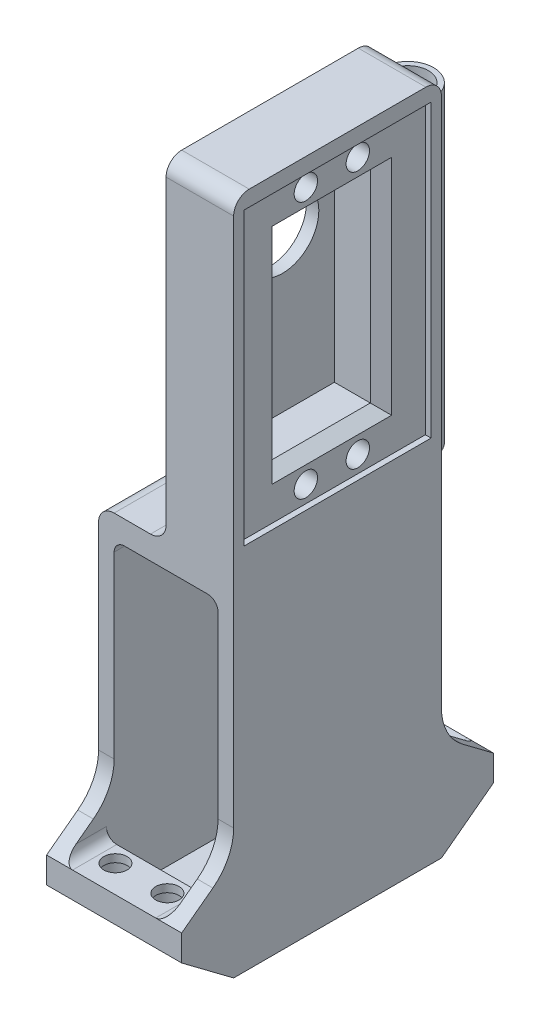
from build123d import *

# Parameters (mm, degrees)
SKETCH_1_W               = 26
SKETCH_1_H               = 60
EXTRUDE_1_DEPTH          = 130
SKETCH_3_W               = 20
SKETCH_3_H               = 49
CUT_EXTRUDE_1_DEPTH      = 180
SKETCH_4_W               = 20
SKETCH_4_H               = 40
CUT_EXTRUDE_3_DEPTH      = 10.5
SKETCH_14_W              = 26
SKETCH_14_H              = 117.5
SKETCH_14_H_2            = 7.5
CUT_EXTRUDE_13_DEPTH     = 10
CUT_EXTRUDE_4_REACH      = 147.52
SKETCH_5_R               = 2.25
CUT_EXTRUDE_2_REACH      = 147.52
SKETCH_2_R               = 7
SKETCH_7_W               = 40
SKETCH_7_H               = 64
CUT_EXTRUDE_5_DEPTH      = 13
SKETCH_6_W               = 20
SKETCH_6_H               = 40
CUT_EXTRUDE_6_DEPTH      = 10.6
SKETCH_8_W               = 36
SKETCH_8_H               = 56
CUT_EXTRUDE_7_DEPTH      = 1.1
SKETCH_9_R               = 7
CUT_EXTRUDE_8_DEPTH      = 145.004027721
SKETCH_10_R              = 2.25
CUT_EXTRUDE_9_DEPTH      = 146.327251402
SKETCH_11_R              = 3.85
CUT_EXTRUDE_10_DEPTH     = 4.7
SKETCH_12_R              = 3.85
CUT_EXTRUDE_11_DEPTH     = 3.5
RIB_2_REACH              = 147.52
SKETCH_16_WALL_W         = 305.539516218
SKETCH_16_WALL_H         = 3
MIRROR_3_COPY_1_REACH    = 147.52
MIRROR_3_COPY_1_SKETCH_W = 305.539516218
MIRROR_3_COPY_1_SKETCH_H = 3
MIRROR_4_COPY_1_REACH    = 147.52
MIRROR_4_COPY_1_SKETCH_W = 305.539516218
MIRROR_4_COPY_1_SKETCH_H = 3
MIRROR_4_COPY_2_REACH    = 147.52
MIRROR_4_COPY_2_SKETCH_W = 305.539516218
MIRROR_4_COPY_2_SKETCH_H = 3
MIRROR_4_COPY_3_REACH    = 147.52
MIRROR_4_COPY_3_SKETCH_W = 305.539516218
MIRROR_4_COPY_3_SKETCH_H = 3
EXTRUDE_START            = -4
EXTRUDE_2_DEPTH          = 60
FILLET_3_R               = 2
CHAMFER_1_SIZE           = 1.5
CHAMFER_1_SIZE_2         = 2.598076211
FILLET_4_R               = 3
FILLET_5_R               = 10
FILLET_6_R               = 1


# Some blends are built 0.0001 mm under size
with BuildPart() as part:
    # 草图1 → 凸台-拉伸1 (new body)
    with BuildSketch(Plane(origin=(0, 0, 0), x_dir=(1, 0, 0), z_dir=(0, 1, 0))):
        with Locations((13, -30)):
            Rectangle(SKETCH_1_W, SKETCH_1_H)
    extrude(amount=EXTRUDE_1_DEPTH)

    # 草图3 → 切除-拉伸1 (cut)
    with BuildSketch(Plane(origin=(0, 0, 0), x_dir=(-1, 0, 0), z_dir=(0, 0, -1))):
        with Locations((-13, 37)):
            Rectangle(SKETCH_3_W, SKETCH_3_H)
    extrude(amount=-CUT_EXTRUDE_1_DEPTH, mode=Mode.SUBTRACT)

    # 草图4 → 切除-拉伸3 (cut)
    with BuildSketch(Plane(origin=(0, 12.5, 0), x_dir=(1, 0, 0), z_dir=(0, 1, 0))):
        with Locations((13, -30)):
            Rectangle(SKETCH_4_W, SKETCH_4_H)
    extrude(amount=-CUT_EXTRUDE_3_DEPTH, mode=Mode.SUBTRACT)

    # 草图14 → 切除-拉伸13 (cut)
    with BuildSketch(Plane(origin=(0, 0, 0), x_dir=(-1, 0, 0), z_dir=(0, 0, -1))):
        with Locations((-13, 71.25)):
            Rectangle(SKETCH_14_W, SKETCH_14_H)
        with Locations((-13, 3.75)):
            Rectangle(SKETCH_14_W, SKETCH_14_H_2)
    cut_extrude_13 = extrude(amount=-CUT_EXTRUDE_13_DEPTH, mode=Mode.SUBTRACT)

    # 镜向1: 切除-拉伸13 across plane
    add(cut_extrude_13.mirror(Plane(origin=(0, 0, 30), x_dir=(1, 0, 0), z_dir=(0, 0, -1))), mode=Mode.SUBTRACT)

    # 草图5 → 切除-拉伸4 (cut, up to next)
    with BuildSketch(Plane.XZ, mode=Mode.PRIVATE) as cut_extrude_4_sk1:
        with Locations(Location((18, 54.75, 0), (0, 0, 270))):
            Circle(SKETCH_5_R)
    cut_extrude_4_tool1 = extrude(cut_extrude_4_sk1.sketch, amount=-CUT_EXTRUDE_4_REACH, mode=Mode.PRIVATE) & part.part
    # 草图5 → 切除-拉伸4 (cut, up to next)
    with BuildSketch(Plane.XZ, mode=Mode.PRIVATE) as cut_extrude_4_sk2:
        with Locations(Location((8, 54.75, 0), (0, 0, 270))):
            Circle(SKETCH_5_R)
    cut_extrude_4_tool2 = extrude(cut_extrude_4_sk2.sketch, amount=-CUT_EXTRUDE_4_REACH, mode=Mode.PRIVATE) & part.part
    # 草图5 → 切除-拉伸4 (cut, up to next)
    with BuildSketch(Plane.XZ, mode=Mode.PRIVATE) as cut_extrude_4_sk3:
        with Locations(Location((18, 5.25, 0), (0, 0, 270))):
            Circle(SKETCH_5_R)
    cut_extrude_4_tool3 = extrude(cut_extrude_4_sk3.sketch, amount=-CUT_EXTRUDE_4_REACH, mode=Mode.PRIVATE) & part.part
    # 草图5 → 切除-拉伸4 (cut, up to next)
    with BuildSketch(Plane.XZ, mode=Mode.PRIVATE) as cut_extrude_4_sk4:
        with Locations(Location((8, 5.25, 0), (0, 0, 270))):
            Circle(SKETCH_5_R)
    cut_extrude_4_tool4 = extrude(cut_extrude_4_sk4.sketch, amount=-CUT_EXTRUDE_4_REACH, mode=Mode.PRIVATE) & part.part
    add(cut_extrude_4_tool1.solids().sort_by_distance((18, 0, 54.75))[0], mode=Mode.SUBTRACT)
    add(cut_extrude_4_tool2.solids().sort_by_distance((8, 0, 54.75))[0], mode=Mode.SUBTRACT)
    add(cut_extrude_4_tool3.solids().sort_by_distance((18, 0, 5.25))[0], mode=Mode.SUBTRACT)
    add(cut_extrude_4_tool4.solids().sort_by_distance((8, 0, 5.25))[0], mode=Mode.SUBTRACT)

    # 草图2 → 切除-拉伸2 (cut, up to next)
    with BuildSketch(Plane.XZ, mode=Mode.PRIVATE) as cut_extrude_2_sk1:
        with Locations(Location((13, 20, 0), (0, 0, 270))):
            Circle(SKETCH_2_R)
    cut_extrude_2_tool1 = extrude(cut_extrude_2_sk1.sketch, amount=-CUT_EXTRUDE_2_REACH, mode=Mode.PRIVATE) & part.part
    add(cut_extrude_2_tool1.solids().sort_by_distance((13, 0, 20))[0], mode=Mode.SUBTRACT)

    # 草图7 → 切除-拉伸5 (cut)
    with BuildSketch(Plane.ZY):
        with Locations((30, 98)):
            Rectangle(SKETCH_7_W, SKETCH_7_H)
    extrude(amount=-CUT_EXTRUDE_5_DEPTH, mode=Mode.SUBTRACT)

    # 草图6 → 切除-拉伸6 (cut)
    with BuildSketch(Plane(origin=(26, 0, 0), x_dir=(0, 0, -1), z_dir=(1, 0, 0))):
        with Locations((-30, 99)):
            Rectangle(SKETCH_6_W, SKETCH_6_H)
    extrude(amount=-CUT_EXTRUDE_6_DEPTH, mode=Mode.SUBTRACT)

    # 草图8 → 切除-拉伸7 (cut)
    with BuildSketch(Plane(origin=(26, 0, 0), x_dir=(0, 0, -1), z_dir=(1, 0, 0))):
        with Locations((-30, 99)):
            Rectangle(SKETCH_8_W, SKETCH_8_H)
    extrude(amount=-CUT_EXTRUDE_7_DEPTH, mode=Mode.SUBTRACT)

    # 草图9 → 切除-拉伸8 (cut, through all)
    with BuildSketch(Plane(origin=(15.4, 0, 0), x_dir=(0, 0, -1), z_dir=(1, 0, 0))):
        with Locations((-30, 109.15)):
            Circle(SKETCH_9_R)
    extrude(amount=-CUT_EXTRUDE_8_DEPTH, mode=Mode.SUBTRACT)

    # 草图10 → 切除-拉伸9 (cut, through all)
    with BuildSketch(Plane(origin=(24.9, 0, 0), x_dir=(0, 0, -1), z_dir=(1, 0, 0))):
        with Locations((-25, 123.75)):
            Circle(SKETCH_10_R)
        with Locations(Location((-35, 123.75, 0), (0, 0, 180))):
            Circle(SKETCH_10_R)
        with Locations((-35, 74.25)):
            Circle(SKETCH_10_R)
        with Locations(Location((-25, 74.25, 0), (0, 0, 180))):
            Circle(SKETCH_10_R)
    extrude(amount=-CUT_EXTRUDE_9_DEPTH, mode=Mode.SUBTRACT)

    # 草图11 → 切除-拉伸10 (cut)
    with BuildSketch(Plane.ZY.offset(-13)):
        with Locations((25, 123.75)):
            Circle(SKETCH_11_R)
        with Locations((35, 123.75)):
            Circle(SKETCH_11_R)
        with Locations((35, 74.25)):
            Circle(SKETCH_11_R)
        with Locations((25, 74.25)):
            Circle(SKETCH_11_R)
    extrude(amount=-CUT_EXTRUDE_10_DEPTH, mode=Mode.SUBTRACT)

    # 草图12 → 切除-拉伸11 (cut)
    with BuildSketch(Plane.XZ.offset(-7.5)):
        with Locations((8, 54.75)):
            Circle(SKETCH_12_R)
        with Locations((18, 54.75)):
            Circle(SKETCH_12_R)
        with Locations((18, 5.25)):
            Circle(SKETCH_12_R)
        with Locations((8, 5.25)):
            Circle(SKETCH_12_R)
    extrude(amount=-CUT_EXTRUDE_11_DEPTH, mode=Mode.SUBTRACT)

    # 草图16 wall → 筋2 (add, up to next)
    with BuildSketch(Plane(origin=(26, 3.75, 5), x_dir=(0, -0.6, 0.8), z_dir=(0, -0.8, -0.6)), mode=Mode.PRIVATE) as rib_2_sk1:
        with Locations((0, 1.5)):
            Rectangle(SKETCH_16_WALL_W, SKETCH_16_WALL_H)
    rib_2_tool1 = extrude(rib_2_sk1.sketch, amount=-RIB_2_REACH, mode=Mode.PRIVATE) - part.part
    rib_2 = rib_2_tool1.solids().sort_by_distance((26, 3.75, 5))[0]
    add(rib_2)

    # 镜向2: 筋2 across plane
    add(rib_2.mirror(Plane.ZY.offset(-13)))

    # 镜向3: 筋2 across plane
    add(rib_2.mirror(Plane(origin=(0, 0, 30), x_dir=(1, 0, 0), z_dir=(0, 0, -1))))

    # 镜向3 copy 1 sketch → 镜向3 copy 1 (add, up to next)
    with BuildSketch(Plane(origin=(0, 3.75, 55), x_dir=(0, -0.6, -0.8), z_dir=(0, -0.8, 0.6)), mode=Mode.PRIVATE) as mirror_3_copy_1_sk1:
        with Locations((0, 1.5)):
            Rectangle(MIRROR_3_COPY_1_SKETCH_W, MIRROR_3_COPY_1_SKETCH_H)
    mirror_3_copy_1_tool1 = extrude(mirror_3_copy_1_sk1.sketch, amount=-MIRROR_3_COPY_1_REACH, mode=Mode.PRIVATE) - part.part
    add(mirror_3_copy_1_tool1.solids().sort_by_distance((0, 3.75, 55))[0])

    # 镜向4: 筋2 across plane
    add(rib_2.mirror(Plane(origin=(0, 10, 0), x_dir=(0, 0, 1), z_dir=(0, -1, 0))))

    # 镜向4 copy 1 sketch → 镜向4 copy 1 (add, up to next)
    with BuildSketch(Plane(origin=(0, 16.25, 5), x_dir=(0, 0.6, 0.8), z_dir=(0, 0.8, -0.6)), mode=Mode.PRIVATE) as mirror_4_copy_1_sk1:
        with Locations((0, 1.5)):
            Rectangle(MIRROR_4_COPY_1_SKETCH_W, MIRROR_4_COPY_1_SKETCH_H)
    mirror_4_copy_1_tool1 = extrude(mirror_4_copy_1_sk1.sketch, amount=-MIRROR_4_COPY_1_REACH, mode=Mode.PRIVATE) - part.part
    add(mirror_4_copy_1_tool1.solids().sort_by_distance((0, 16.25, 5))[0])

    # 镜向4 copy 2 sketch → 镜向4 copy 2 (add, up to next)
    with BuildSketch(Plane(origin=(26, 16.25, 55), x_dir=(0, 0.6, -0.8), z_dir=(0, 0.8, 0.6)), mode=Mode.PRIVATE) as mirror_4_copy_2_sk1:
        with Locations((0, 1.5)):
            Rectangle(MIRROR_4_COPY_2_SKETCH_W, MIRROR_4_COPY_2_SKETCH_H)
    mirror_4_copy_2_tool1 = extrude(mirror_4_copy_2_sk1.sketch, amount=-MIRROR_4_COPY_2_REACH, mode=Mode.PRIVATE) - part.part
    add(mirror_4_copy_2_tool1.solids().sort_by_distance((26, 16.25, 55))[0])

    # 镜向4 copy 3 sketch → 镜向4 copy 3 (add, up to next)
    with BuildSketch(Plane(origin=(0, 16.25, 55), x_dir=(0, 0.6, -0.8), z_dir=(0, 0.8, 0.6)), mode=Mode.PRIVATE) as mirror_4_copy_3_sk1:
        with Locations((0, -1.5)):
            Rectangle(MIRROR_4_COPY_3_SKETCH_W, MIRROR_4_COPY_3_SKETCH_H)
    mirror_4_copy_3_tool1 = extrude(mirror_4_copy_3_sk1.sketch, amount=-MIRROR_4_COPY_3_REACH, mode=Mode.PRIVATE) - part.part
    add(mirror_4_copy_3_tool1.solids().sort_by_distance((0, 16.25, 55))[0])

    # 草图17 → 凸台-拉伸2 (add)
    with BuildSketch(Plane(origin=(0, 130, 0), x_dir=(1, 0, 0), z_dir=(0, 1, 0)).offset(EXTRUDE_START)):
        with BuildLine():
            Line((14.5, -10), (15.5, -10))
            ThreePointArc((15.5, -10), (19.5, -6), (23.5, -10))
            Line((23.5, -10), (24.5, -10))
            ThreePointArc((24.5, -10), (19.5, -5), (14.5, -10))
        make_face()
    extrude(amount=-EXTRUDE_2_DEPTH)

    # 圆角3
    fillet_3_edges = [part.edges().sort_by_distance(p)[0] for p in [
        (3, 12.5, 55),
        (23, 12.5, 55),
        (3, 12.5, 5),
        (23, 12.5, 5),
        (23, 61.5, 30),
        (3, 61.5, 30),
    ]]
    fillet(fillet_3_edges, radius=FILLET_3_R)

    # 倒角1
    # the kernel refuses this chamfer: 2.598076211, 1.5 mm, written as the material it takes off along each edge
    with BuildSketch(Plane(origin=(24.9, 119, 40), x_dir=(0, 1, 0), z_dir=(0, 0, -1)), Plane(origin=(24.9, 79, 20), x_dir=(0, -1, 0), z_dir=(0, 0, 1))) as chamfer_1_piece_1:
        Polygon((CHAMFER_1_SIZE, 0), (0, -CHAMFER_1_SIZE_2), (0, 0), align=None)
    extrude(amount=20, mode=Mode.SUBTRACT)
    with BuildSketch(Plane(origin=(24.9, 79, 40), x_dir=(0, 0, 1), z_dir=(0, 1, 0)), Plane(origin=(24.9, 119, 20), x_dir=(0, 0, -1), z_dir=(0, -1, 0))) as chamfer_1_piece_2:
        Polygon((CHAMFER_1_SIZE, 0), (0, -CHAMFER_1_SIZE_2), (0, 0), align=None)
    extrude(amount=40, mode=Mode.SUBTRACT)
    with BuildSketch(Plane(origin=(5, 12.5, 10), x_dir=(0, -1, 0), z_dir=(1, 0, 0)), Plane(origin=(21, 12.5, 50), x_dir=(0, -1, 0), z_dir=(-1, 0, 0))) as chamfer_1_piece_3:
        Polygon((CHAMFER_1_SIZE_2, 0), (0, CHAMFER_1_SIZE), (0, 0), align=None)
    extrude(amount=16, mode=Mode.SUBTRACT)
    with BuildSketch(Plane(origin=(21, 14.5, 10), x_dir=(-0.9757925092346341, -0.21869837430026012, 0), z_dir=(0.21869837430026012, -0.9757925092346341, 0))) as chamfer_1_piece_4_section:
        Polygon((2 + CHAMFER_1_SIZE_2, 0), (2, CHAMFER_1_SIZE), (2, 0), align=None)
    chamfer_1_piece_4 = revolve(axis=Axis((21, 14.5, 10), (0, 0, -1)), revolution_arc=282.63259376, mode=Mode.PRIVATE)
    chamfer_1_piece_4 = split(chamfer_1_piece_4, bisect_by=Plane(origin=(23, 14.5, 10), z_dir=(-1, 0, 0)), keep=Keep.TOP, mode=Mode.PRIVATE)
    add(chamfer_1_piece_4, mode=Mode.SUBTRACT)
    with BuildSketch(Plane(origin=(5, 14.5, 10), x_dir=(0, -1, 0), z_dir=(1, 0, 0))) as chamfer_1_piece_5_section:
        Polygon((2 + CHAMFER_1_SIZE_2, 0), (2, CHAMFER_1_SIZE), (2, 0), align=None)
    chamfer_1_piece_5 = revolve(axis=Axis((5, 14.5, 10), (0, 0, -1)), revolution_arc=282.63259376, mode=Mode.PRIVATE)
    chamfer_1_piece_5 = split(chamfer_1_piece_5, bisect_by=Plane(origin=(3, 14.5, 10), z_dir=(1, 0, 0)), keep=Keep.TOP, mode=Mode.PRIVATE)
    add(chamfer_1_piece_5, mode=Mode.SUBTRACT)
    with BuildSketch(Plane(origin=(5, 14.5, 50), x_dir=(0, -1, 0), z_dir=(1, 0, 0))) as chamfer_1_piece_6_section:
        Polygon((2 + CHAMFER_1_SIZE_2, 0), (2, -CHAMFER_1_SIZE), (2, 0), align=None)
    chamfer_1_piece_6 = revolve(axis=Axis((5, 14.5, 50), (0, 0, -1)), revolution_arc=282.63259376, mode=Mode.PRIVATE)
    chamfer_1_piece_6 = split(chamfer_1_piece_6, bisect_by=Plane(origin=(3, 14.5, 50), z_dir=(1, 0, 0)), keep=Keep.TOP, mode=Mode.PRIVATE)
    add(chamfer_1_piece_6, mode=Mode.SUBTRACT)
    with BuildSketch(Plane(origin=(21, 14.5, 50), x_dir=(-0.9757925092346331, -0.21869837430026434, 0), z_dir=(0.21869837430026434, -0.9757925092346331, 0))) as chamfer_1_piece_7_section:
        Polygon((2 + CHAMFER_1_SIZE_2, 0), (2, -CHAMFER_1_SIZE), (2, 0), align=None)
    chamfer_1_piece_7 = revolve(axis=Axis((21, 14.5, 50), (0, 0, -1)), revolution_arc=282.63259376, mode=Mode.PRIVATE)
    chamfer_1_piece_7 = split(chamfer_1_piece_7, bisect_by=Plane(origin=(23, 14.5, 50), z_dir=(-1, 0, 0)), keep=Keep.TOP, mode=Mode.PRIVATE)
    add(chamfer_1_piece_7, mode=Mode.SUBTRACT)
    with BuildSketch(Plane(origin=(24.9, 79, 40), x_dir=(0, 0, 1), z_dir=(0, 1, 0))) as chamfer_1_piece_8a_section:
        Polygon((CHAMFER_1_SIZE, 0), (0, -CHAMFER_1_SIZE_2), (0, 0), align=None)
    chamfer_1_piece_8a = extrude(amount=46.721445956, mode=Mode.PRIVATE)
    chamfer_1_piece_8a = split(chamfer_1_piece_8a, bisect_by=Plane(origin=(24.9, 119, 40), z_dir=(0, 1, 0)), keep=Keep.TOP, mode=Mode.PRIVATE)
    with BuildSketch(Plane(origin=(24.9, 119, 46.721445956), x_dir=(0, 1, 0), z_dir=(0, 0, -1))) as chamfer_1_piece_8b_section:
        Polygon((CHAMFER_1_SIZE, 0), (0, -CHAMFER_1_SIZE_2), (0, 0), align=None)
    chamfer_1_piece_8b = extrude(amount=26.721445956, mode=Mode.PRIVATE)
    chamfer_1_piece_8b = split(chamfer_1_piece_8b, bisect_by=Plane(origin=(24.9, 119, 40), z_dir=(0, 0, 1)), keep=Keep.TOP, mode=Mode.PRIVATE)
    chamfer_1_piece_8 = chamfer_1_piece_8a & chamfer_1_piece_8b
    add(chamfer_1_piece_8, mode=Mode.SUBTRACT)
    with BuildSketch(Plane(origin=(24.9, 125.721445956, 20), x_dir=(0, 0, -1), z_dir=(0, -1, 0))) as chamfer_1_piece_9a_section:
        Polygon((CHAMFER_1_SIZE, 0), (0, -CHAMFER_1_SIZE_2), (0, 0), align=None)
    chamfer_1_piece_9a = extrude(amount=46.721445956, mode=Mode.PRIVATE)
    chamfer_1_piece_9a = split(chamfer_1_piece_9a, bisect_by=Plane(origin=(24.9, 119, 20), z_dir=(0, 1, 0)), keep=Keep.TOP, mode=Mode.PRIVATE)
    with BuildSketch(Plane(origin=(24.9, 119, 40), x_dir=(0, 1, 0), z_dir=(0, 0, -1))) as chamfer_1_piece_9b_section:
        Polygon((CHAMFER_1_SIZE, 0), (0, -CHAMFER_1_SIZE_2), (0, 0), align=None)
    chamfer_1_piece_9b = extrude(amount=26.721445956, mode=Mode.PRIVATE)
    chamfer_1_piece_9b = split(chamfer_1_piece_9b, bisect_by=Plane(origin=(24.9, 119, 20), z_dir=(0, 0, -1)), keep=Keep.TOP, mode=Mode.PRIVATE)
    chamfer_1_piece_9 = chamfer_1_piece_9a & chamfer_1_piece_9b
    add(chamfer_1_piece_9, mode=Mode.SUBTRACT)
    with BuildSketch(Plane(origin=(24.9, 79, 20), x_dir=(0, -1, 0), z_dir=(0, 0, 1))) as chamfer_1_piece_10a_section:
        Polygon((CHAMFER_1_SIZE, 0), (0, -CHAMFER_1_SIZE_2), (0, 0), align=None)
    chamfer_1_piece_10a = extrude(amount=26.721445956, mode=Mode.PRIVATE)
    chamfer_1_piece_10a = split(chamfer_1_piece_10a, bisect_by=Plane(origin=(24.9, 79, 40), z_dir=(0, 0, 1)), keep=Keep.TOP, mode=Mode.PRIVATE)
    with BuildSketch(Plane(origin=(24.9, 72.278554044, 40), x_dir=(0, 0, 1), z_dir=(0, 1, 0))) as chamfer_1_piece_10b_section:
        Polygon((CHAMFER_1_SIZE, 0), (0, -CHAMFER_1_SIZE_2), (0, 0), align=None)
    chamfer_1_piece_10b = extrude(amount=46.721445956, mode=Mode.PRIVATE)
    chamfer_1_piece_10b = split(chamfer_1_piece_10b, bisect_by=Plane(origin=(24.9, 79, 40), z_dir=(0, -1, 0)), keep=Keep.TOP, mode=Mode.PRIVATE)
    chamfer_1_piece_10 = chamfer_1_piece_10a & chamfer_1_piece_10b
    add(chamfer_1_piece_10, mode=Mode.SUBTRACT)
    with BuildSketch(Plane(origin=(24.9, 79, 13.278554044), x_dir=(0, -1, 0), z_dir=(0, 0, 1))) as chamfer_1_piece_11a_section:
        Polygon((CHAMFER_1_SIZE, 0), (0, -CHAMFER_1_SIZE_2), (0, 0), align=None)
    chamfer_1_piece_11a = extrude(amount=26.721445956, mode=Mode.PRIVATE)
    chamfer_1_piece_11a = split(chamfer_1_piece_11a, bisect_by=Plane(origin=(24.9, 79, 20), z_dir=(0, 0, -1)), keep=Keep.TOP, mode=Mode.PRIVATE)
    with BuildSketch(Plane(origin=(24.9, 119, 20), x_dir=(0, 0, -1), z_dir=(0, -1, 0))) as chamfer_1_piece_11b_section:
        Polygon((CHAMFER_1_SIZE, 0), (0, -CHAMFER_1_SIZE_2), (0, 0), align=None)
    chamfer_1_piece_11b = extrude(amount=46.721445956, mode=Mode.PRIVATE)
    chamfer_1_piece_11b = split(chamfer_1_piece_11b, bisect_by=Plane(origin=(24.9, 79, 20), z_dir=(0, -1, 0)), keep=Keep.TOP, mode=Mode.PRIVATE)
    chamfer_1_piece_11 = chamfer_1_piece_11a & chamfer_1_piece_11b
    add(chamfer_1_piece_11, mode=Mode.SUBTRACT)

    # 圆角4
    # the kernel refuses this fillet: 3 mm, written as the material it adds along each edge
    with BuildSketch(Plane(origin=(13, 66, 10), x_dir=(0, 1, 0), z_dir=(0, 0, 1))) as fillet_4_piece_1:
        with BuildLine():
            CenterArc((FILLET_4_R, FILLET_4_R), FILLET_4_R, 180, 90)
            Line((0, FILLET_4_R), (0, 0))
            Line((0, 0), (FILLET_4_R, 0))
        make_face()
    extrude(amount=40)
    with BuildSketch(Plane(origin=(23, 0, 10), x_dir=(-1, 0, 0), z_dir=(0, 1, 0))) as fillet_4_piece_2_section:
        with BuildLine():
            CenterArc((FILLET_4_R, -FILLET_4_R), FILLET_4_R, 90, 90)
            Line((0, -FILLET_4_R), (0, 0))
            Line((0, 0), (FILLET_4_R, 0))
        make_face()
    fillet_4_piece_2 = extrude(amount=2, mode=Mode.PRIVATE)
    fillet_4_piece_2 = split(fillet_4_piece_2, bisect_by=Plane(origin=(23, 0, 10), z_dir=(0, 0.8, 0.6)), keep=Keep.TOP, mode=Mode.PRIVATE)
    add(fillet_4_piece_2)
    with BuildSketch(Plane(origin=(3, 0, 10), x_dir=(1, 0, 0), z_dir=(0, 1, 0))) as fillet_4_piece_3_section:
        with BuildLine():
            CenterArc((FILLET_4_R, FILLET_4_R), FILLET_4_R, 180, 90)
            Line((0, FILLET_4_R), (0, 0))
            Line((0, 0), (FILLET_4_R, 0))
        make_face()
    fillet_4_piece_3 = extrude(amount=2, mode=Mode.PRIVATE)
    fillet_4_piece_3 = split(fillet_4_piece_3, bisect_by=Plane(origin=(3, 0, 10), z_dir=(0, 0.8, 0.6)), keep=Keep.TOP, mode=Mode.PRIVATE)
    add(fillet_4_piece_3)
    with BuildSketch(Plane(origin=(3, 0, 50), x_dir=(1, 0, 0), z_dir=(0, 1, 0))) as fillet_4_piece_4_section:
        with BuildLine():
            CenterArc((FILLET_4_R, -FILLET_4_R), FILLET_4_R, 90, 90)
            Line((0, -FILLET_4_R), (0, 0))
            Line((0, 0), (FILLET_4_R, 0))
        make_face()
    fillet_4_piece_4 = extrude(amount=2, mode=Mode.PRIVATE)
    fillet_4_piece_4 = split(fillet_4_piece_4, bisect_by=Plane(origin=(3, 0, 50), z_dir=(0, 0.8, -0.6)), keep=Keep.TOP, mode=Mode.PRIVATE)
    add(fillet_4_piece_4)
    with BuildSketch(Plane(origin=(23, 0, 50), x_dir=(-1, 0, 0), z_dir=(0, 1, 0))) as fillet_4_piece_5_section:
        with BuildLine():
            CenterArc((FILLET_4_R, FILLET_4_R), FILLET_4_R, 180, 90)
            Line((0, FILLET_4_R), (0, 0))
            Line((0, 0), (FILLET_4_R, 0))
        make_face()
    fillet_4_piece_5 = extrude(amount=2, mode=Mode.PRIVATE)
    fillet_4_piece_5 = split(fillet_4_piece_5, bisect_by=Plane(origin=(23, 0, 50), z_dir=(0, 0.8, -0.6)), keep=Keep.TOP, mode=Mode.PRIVATE)
    add(fillet_4_piece_5)
    # the kernel refuses this fillet: 3 mm, written as the material it takes off along each edge
    with BuildSketch(Plane(origin=(33.5, 130, 50), x_dir=(0, -1, 0), z_dir=(-1, 0, 0))) as fillet_4_2_piece_1:
        with BuildLine():
            CenterArc((FILLET_4_R, -FILLET_4_R), FILLET_4_R, 90, 90)
            Line((0, -FILLET_4_R), (0, 0))
            Line((0, 0), (FILLET_4_R, 0))
        make_face()
    extrude(amount=28, mode=Mode.SUBTRACT)
    with BuildSketch(Plane(origin=(33.5, 130, 10), x_dir=(0, -1, 0), z_dir=(-1, 0, 0))) as fillet_4_2_piece_2:
        with BuildLine():
            CenterArc((FILLET_4_R, FILLET_4_R), FILLET_4_R, 180, 90)
            Line((0, FILLET_4_R), (0, 0))
            Line((0, 0), (FILLET_4_R, 0))
        make_face()
    extrude(amount=28, mode=Mode.SUBTRACT)
    with BuildSketch(Plane(origin=(0, 66, 2.5), x_dir=(1, 0, 0), z_dir=(0, 0, 1))) as fillet_4_2_piece_3:
        with BuildLine():
            CenterArc((FILLET_4_R, -FILLET_4_R), FILLET_4_R, 90, 90)
            Line((0, -FILLET_4_R), (0, 0))
            Line((0, 0), (FILLET_4_R, 0))
        make_face()
    extrude(amount=55, mode=Mode.SUBTRACT)

    # 圆角5
    fillet_5_edges = [part.edges().sort_by_distance(p)[0] for p in [
        (1.5, 20, 50),
        (24.5, 20, 50),
        (1.5, 20, 10),
        (24.5, 20, 10),
    ]]
    fillet(fillet_5_edges, radius=FILLET_5_R)

    # 圆角6
    fillet_6_edges = [part.edges().sort_by_distance(p)[0] for p in [
        (15, 66, 10),
        (14.5, 96, 10),
        (24, 66, 10),
        (24.5, 96, 10),
        (24, 126, 10),
        (15, 126, 10),
    ]]
    fillet(fillet_6_edges, radius=FILLET_6_R - 0.0001)  # a hair under: the kernel refuses the full size


solid = part.part
